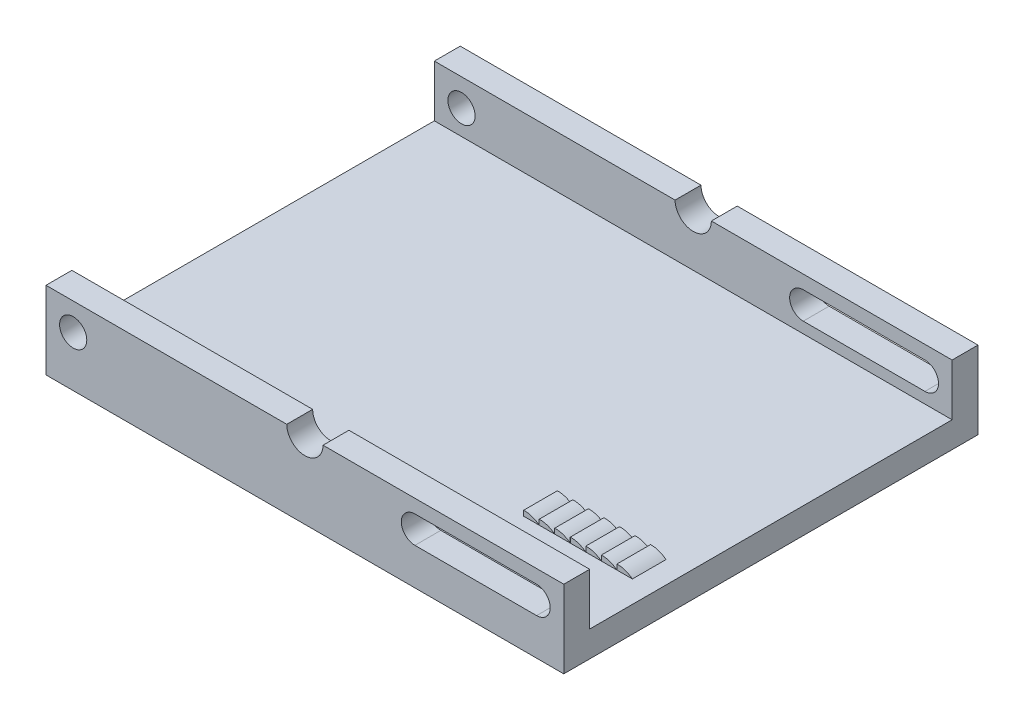
from build123d import *

# Parameters (mm, degrees)
AUFSATZ_LINEAR_AUSTRAGEN3_DEPTH      = 100
SCHNITT_LINEAR_AUSTRAGEN1_DEPTH      = 192.049731745
SCHNITT_LINEAR_AUSTRAGEN1_DEPTH_BACK = 192.049731745
SKIZZE10_R                           = 5.25
SCHNITT_LINEAR_AUSTRAGEN2_DEPTH      = 132.52946438
SCHNITT_LINEAR_AUSTRAGEN2_DEPTH_BACK = 132.52946438
AUFSATZ_LINEAR_AUSTRAGEN4_DEPTH      = 45
LINEARES_MUSTER1_COUNT               = 7
LINEARES_MUSTER1_PITCH               = 6
SKIZZE19_W                           = 200
SKIZZE19_H                           = 20
SCHNITT_LINEAR_AUSTRAGEN3_DEPTH      = 32


with BuildPart() as part:
    # Skizze9 → Aufsatz-Linear austragen3 (new, symmetric)
    with BuildSketch(Plane(origin=(0, 0, 0), x_dir=(0, 0, -1), z_dir=(1, 0, 0))):
        Polygon((-80, 30), (-80, 0), (80, 0), (80, 30), (70, 30), (70, 10), (-70, 10), (-70, 30), align=None)
    extrude(amount=AUFSATZ_LINEAR_AUSTRAGEN3_DEPTH, both=True)

    # Skizze10 → Schnitt-Linear austragen1 (cut, two sides: drawn at the far end of the back side and taken through both)
    with BuildSketch(Plane.XY.offset(80).offset(-SCHNITT_LINEAR_AUSTRAGEN1_DEPTH_BACK)):
        with Locations((-89.5, 19.5)):
            Circle(SKIZZE10_R)
        with BuildLine():
            Line((42.5, 24.75), (89.5, 24.75))
            ThreePointArc((89.5, 24.75), (94.75, 19.5), (89.5, 14.25))
            Line((89.5, 14.25), (42.5, 14.25))
            ThreePointArc((42.5, 14.25), (37.25, 19.5), (42.5, 24.75))
        make_face()
    extrude(amount=SCHNITT_LINEAR_AUSTRAGEN1_DEPTH + SCHNITT_LINEAR_AUSTRAGEN1_DEPTH_BACK, mode=Mode.SUBTRACT)

    # Skizze12 → Schnitt-Linear austragen2 (cut, two sides: drawn at the far end of the back side and taken through both)
    with BuildSketch(Plane.XY.offset(-SCHNITT_LINEAR_AUSTRAGEN2_DEPTH_BACK)):
        with BuildLine():
            Line((-7, 30), (7, 30))
            ThreePointArc((7, 30), (0, 23), (-7, 30))
        make_face()
    extrude(amount=SCHNITT_LINEAR_AUSTRAGEN2_DEPTH + SCHNITT_LINEAR_AUSTRAGEN2_DEPTH_BACK, mode=Mode.SUBTRACT)

    # Skizze18 → Aufsatz-Linear austragen4 (add)
    with BuildSketch(Plane(origin=(0, 0, 0), x_dir=(-1, 0, 0), z_dir=(0, 0, -1))):
        with BuildLine():
            Line((-49.5, 10), (-55.5, 10))
            add(Edge.make_bspline(
                [(-55.5, 10), (-52.66767955, 12.124664511), (-49.5, 12)],
                knots=[0, 0, 0, 0.477297659, 0.477297659, 0.477297659], degree=2))
            Line((-49.5, 12), (-49.5, 10))
        make_face()
    aufsatz_linear_austragen4 = extrude(amount=-AUFSATZ_LINEAR_AUSTRAGEN4_DEPTH)

    # Lineares Muster1: Aufsatz-Linear austragen4 ×7
    with Locations(*[(i * LINEARES_MUSTER1_PITCH, 0, 0) for i in range(1, LINEARES_MUSTER1_COUNT)]):
        add(aufsatz_linear_austragen4)

    # Skizze19 → Schnitt-Linear austragen3 (cut)
    with BuildSketch(Plane.XY):
        with Locations((0, 20)):
            Rectangle(SKIZZE19_W, SKIZZE19_H)
    extrude(amount=SCHNITT_LINEAR_AUSTRAGEN3_DEPTH, mode=Mode.SUBTRACT)


solid = part.part
